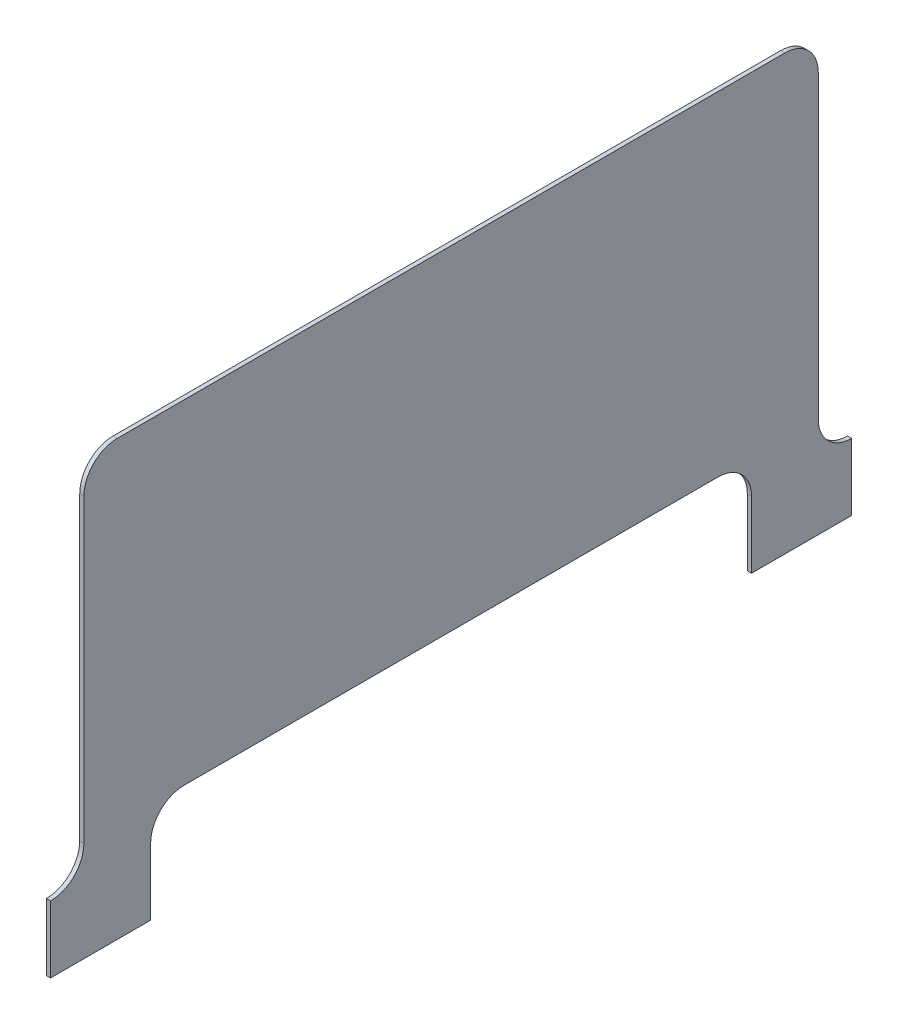
from build123d import *

# Parameters (mm, degrees)
SKETCH1_W          = 3.175
SKETCH1_H          = 330.2
EXTRUDE1_DEPTH     = 304.8
CUT_EXTRUDE1_DEPTH = 450.38308894
SKETCH3_W          = 457.2
SKETCH3_H          = 76.2
CUT_EXTRUDE2_DEPTH = 450.38308894
FILLET1_R          = 25.4


with BuildPart() as part:
    # Sketch1 → Extrude1 (new, symmetric)
    with BuildSketch(Plane.XY):
        with Locations((-77.7875, 165.1)):
            Rectangle(SKETCH1_W, SKETCH1_H)
    extrude(amount=EXTRUDE1_DEPTH, both=True)

    # Sketch2 → Cut-Extrude1 (cut, through all)
    with BuildSketch(Plane.ZY.offset(79.375)):
        with BuildLine():
            Line((279.4, 330.2), (279.4, 76.2))
            ThreePointArc((279.4, 76.2), (286.839487758, 58.239487758), (304.8, 50.8))
            Line((304.8, 50.8), (304.8, 330.2))
            Line((304.8, 330.2), (279.4, 330.2))
        make_face()
        with BuildLine():
            Line((-279.4, 330.2), (-279.4, 76.2))
            ThreePointArc((-279.4, 76.2), (-286.839487758, 58.239487758), (-304.8, 50.8))
            Line((-304.8, 50.8), (-304.8, 330.2))
            Line((-304.8, 330.2), (-279.4, 330.2))
        make_face()
    extrude(amount=-CUT_EXTRUDE1_DEPTH, mode=Mode.SUBTRACT)

    # Sketch3 → Cut-Extrude2 (cut, through all)
    with BuildSketch(Plane.ZY.offset(79.375)):
        with Locations((0, 38.1)):
            Rectangle(SKETCH3_W, SKETCH3_H)
    extrude(amount=-CUT_EXTRUDE2_DEPTH, mode=Mode.SUBTRACT)

    # Fillet1
    fillet1_edges = [part.edges().sort_by_distance(p)[0] for p in [
        (-77.7875, 76.2, 228.6),
        (-77.7875, 76.2, -228.6),
        (-77.7875, 330.2, -279.4),
        (-77.7875, 330.2, 279.4),
    ]]
    fillet(fillet1_edges, radius=FILLET1_R)


solid = part.part
